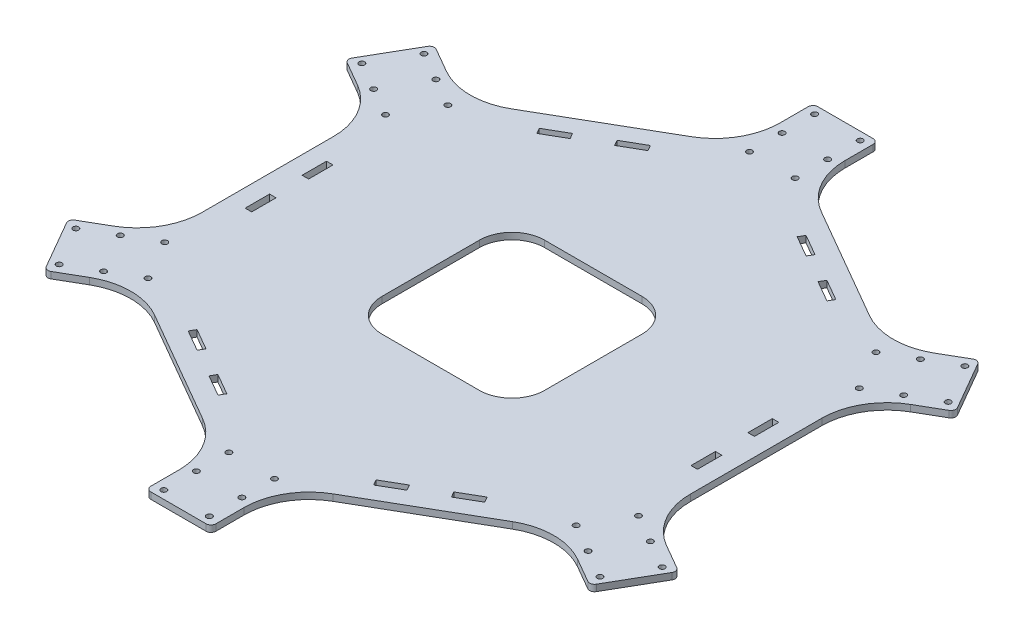
from build123d import *

# Parameters (mm, degrees)
SKETCH4_R           = 1.75
SKETCH4_W           = 4
SKETCH4_H           = 15
BOSS_EXTRUDE3_DEPTH = 2
FILLET1_R           = 3
CIRPATTERN4_START   = -2
CIRPATTERN4_DEPTH   = 4
CUT_EXTRUDE1_DEPTH  = 4


# Read off the part's stored shape, not the designer's step: CirPattern4
with BuildPart() as part:
    # Sketch4 → Boss-Extrude3 (new, symmetric)
    with BuildSketch(Plane(origin=(0, 0, 0), x_dir=(1, 0, 0), z_dir=(0, 1, 0))):
        with BuildLine():
            Line((-109.999962696, -109.696549489), (-39.999982783, -150.111103124))
            ThreePointArc((-39.999982783, -150.111103124), (-25.358978878, -164.752117943), (-20, -184.752109335))
            Line((-20, -184.752109335), (-20, -205))
            Line((-20, -205), (20, -205))
            Line((20, -205), (20, -184.752062947))
            ThreePointArc((20, -184.752062947), (25.358988819, -164.752054338), (40.000017217, -150.111036855))
            Line((40.000017217, -150.111036855), (110.000037304, -109.696552803))
            ThreePointArc((110.000037304, -109.696552803), (130.000030027, -104.337578894), (150.000020087, -109.696562743))
            Line((150.000020087, -109.696562743), (167.535207776, -119.820508076))
            Line((167.535207776, -119.820508076), (187.535207776, -85.179491924))
            Line((187.535207776, -85.179491924), (169.999979913, -75.055523398))
            ThreePointArc((169.999979913, -75.055523398), (155.358958792, -60.414498638), (149.999979913, -40.414487366))
            Line((149.999979913, -40.414487366), (150.000020087, 40.414550321))
            ThreePointArc((150.000020087, 40.414550321), (155.359008905, 60.414539049), (170.000020087, 75.055546592))
            Line((170.000020087, 75.055546592), (187.535207776, 85.179491924))
            Line((187.535207776, 85.179491924), (167.535207776, 119.820508076))
            Line((167.535207776, 119.820508076), (149.999979913, 109.696539549))
            ThreePointArc((149.999979913, 109.696539549), (129.999969973, 104.3375557), (109.999962696, 109.696549489))
            Line((109.999962696, 109.696549489), (39.999982783, 150.111103124))
            ThreePointArc((39.999982783, 150.111103124), (25.358978878, 164.752117943), (20, 184.752109335))
            Line((20, 184.752109335), (20, 205))
            Line((20, 205), (-20, 205))
            Line((-20, 205), (-20, 184.752062947))
            ThreePointArc((-20, 184.752062947), (-25.358988819, 164.752054338), (-40.000017217, 150.111036855))
            Line((-40.000017217, 150.111036855), (-110.000037304, 109.696552803))
            ThreePointArc((-110.000037304, 109.696552803), (-130.000030027, 104.337578894), (-150.000020087, 109.696562743))
            Line((-150.000020087, 109.696562743), (-167.535207776, 119.820508076))
            Line((-167.535207776, 119.820508076), (-187.535207776, 85.179491924))
            Line((-187.535207776, 85.179491924), (-169.999979913, 75.055523398))
            ThreePointArc((-169.999979913, 75.055523398), (-155.358958792, 60.414498638), (-149.999979913, 40.414487366))
            Line((-149.999979913, 40.414487366), (-150.000020087, -40.414550321))
            ThreePointArc((-150.000020087, -40.414550321), (-155.359008905, -60.414539049), (-170.000020087, -75.055546592))
            Line((-170.000020087, -75.055546592), (-187.535207776, -85.179491924))
            Line((-187.535207776, -85.179491924), (-167.535207776, -119.820508076))
            Line((-167.535207776, -119.820508076), (-149.999979913, -109.696539549))
            ThreePointArc((-149.999979913, -109.696539549), (-129.999969973, -104.3375557), (-109.999962696, -109.696549489))
        make_face()
        with Locations(Location((-14, 200, 0), (0, 0, 270))):
            Circle(SKETCH4_R, mode=Mode.SUBTRACT)
        with Locations(Location((-14, 180, 0), (0, 0, 270))):
            Circle(SKETCH4_R, mode=Mode.SUBTRACT)
        with Locations(Location((-14, 160, 0), (0, 0, 270))):
            Circle(SKETCH4_R, mode=Mode.SUBTRACT)
        with Locations(Location((14, 200, 0), (0, 0, 270))):
            Circle(SKETCH4_R, mode=Mode.SUBTRACT)
        with Locations(Location((14, 180, 0), (0, 0, 270))):
            Circle(SKETCH4_R, mode=Mode.SUBTRACT)
        with Locations(Location((14, 160, 0), (0, 0, 270))):
            Circle(SKETCH4_R, mode=Mode.SUBTRACT)
        with Locations(Location((131.564064606, 92.124355653, 0), (0, 0, 270))):
            Circle(SKETCH4_R, mode=Mode.SUBTRACT)
        with Locations(Location((148.884572681, 102.124355653, 0), (0, 0, 270))):
            Circle(SKETCH4_R, mode=Mode.SUBTRACT)
        with Locations(Location((145.564064606, 67.875644347, 0), (0, 0, 270))):
            Circle(SKETCH4_R, mode=Mode.SUBTRACT)
        with Locations(Location((180.205080757, 87.875644347, 0), (0, 0, 270))):
            Circle(SKETCH4_R, mode=Mode.SUBTRACT)
        with Locations(Location((162.884572681, 77.875644347, 0), (0, 0, 270))):
            Circle(SKETCH4_R, mode=Mode.SUBTRACT)
        with Locations(Location((166.205080757, 112.124355653, 0), (0, 0, 270))):
            Circle(SKETCH4_R, mode=Mode.SUBTRACT)
        with Locations(Location((145.564064606, -67.875644347, 0), (0, 0, 270))):
            Circle(SKETCH4_R, mode=Mode.SUBTRACT)
        with Locations(Location((162.884572681, -77.875644347, 0), (0, 0, 270))):
            Circle(SKETCH4_R, mode=Mode.SUBTRACT)
        with Locations(Location((131.564064606, -92.124355653, 0), (0, 0, 270))):
            Circle(SKETCH4_R, mode=Mode.SUBTRACT)
        with Locations(Location((166.205080757, -112.124355653, 0), (0, 0, 270))):
            Circle(SKETCH4_R, mode=Mode.SUBTRACT)
        with Locations(Location((148.884572681, -102.124355653, 0), (0, 0, 270))):
            Circle(SKETCH4_R, mode=Mode.SUBTRACT)
        with Locations(Location((180.205080757, -87.875644347, 0), (0, 0, 270))):
            Circle(SKETCH4_R, mode=Mode.SUBTRACT)
        with Locations(Location((14, -160, 0), (0, 0, 270))):
            Circle(SKETCH4_R, mode=Mode.SUBTRACT)
        with Locations(Location((14, -180, 0), (0, 0, 270))):
            Circle(SKETCH4_R, mode=Mode.SUBTRACT)
        with Locations(Location((-14, -160, 0), (0, 0, 270))):
            Circle(SKETCH4_R, mode=Mode.SUBTRACT)
        with Locations(Location((-14, -200, 0), (0, 0, 270))):
            Circle(SKETCH4_R, mode=Mode.SUBTRACT)
        with Locations(Location((-14, -180, 0), (0, 0, 270))):
            Circle(SKETCH4_R, mode=Mode.SUBTRACT)
        with Locations(Location((14, -200, 0), (0, 0, 270))):
            Circle(SKETCH4_R, mode=Mode.SUBTRACT)
        with Locations(Location((-131.564064605, -92.124355653, 0), (0, 0, 270))):
            Circle(SKETCH4_R, mode=Mode.SUBTRACT)
        with Locations(Location((-148.884572681, -102.124355653, 0), (0, 0, 270))):
            Circle(SKETCH4_R, mode=Mode.SUBTRACT)
        with Locations(Location((-145.564064605, -67.875644347, 0), (0, 0, 270))):
            Circle(SKETCH4_R, mode=Mode.SUBTRACT)
        with Locations(Location((-180.205080757, -87.875644347, 0), (0, 0, 270))):
            Circle(SKETCH4_R, mode=Mode.SUBTRACT)
        with Locations(Location((-162.884572681, -77.875644347, 0), (0, 0, 270))):
            Circle(SKETCH4_R, mode=Mode.SUBTRACT)
        with Locations(Location((-166.205080757, -112.124355653, 0), (0, 0, 270))):
            Circle(SKETCH4_R, mode=Mode.SUBTRACT)
        with Locations(Location((-145.564064606, 67.875644347, 0), (0, 0, 270))):
            Circle(SKETCH4_R, mode=Mode.SUBTRACT)
        with Locations(Location((-162.884572681, 77.875644347, 0), (0, 0, 270))):
            Circle(SKETCH4_R, mode=Mode.SUBTRACT)
        with Locations(Location((-131.564064606, 92.124355653, 0), (0, 0, 270))):
            Circle(SKETCH4_R, mode=Mode.SUBTRACT)
        with Locations(Location((-166.205080757, 112.124355653, 0), (0, 0, 270))):
            Circle(SKETCH4_R, mode=Mode.SUBTRACT)
        with Locations(Location((-148.884572681, 102.124355653, 0), (0, 0, 270))):
            Circle(SKETCH4_R, mode=Mode.SUBTRACT)
        with Locations(Location((-180.205080757, 87.875644347, 0), (0, 0, 270))):
            Circle(SKETCH4_R, mode=Mode.SUBTRACT)
        with Locations((137, 17.5)):
            Rectangle(SKETCH4_W, SKETCH4_H, mode=Mode.SUBTRACT)
        with Locations((137, -17.5)):
            Rectangle(SKETCH4_W, SKETCH4_H, mode=Mode.SUBTRACT)
        Polygon((60.839745962, -125.377531126), (47.849364905, -132.877531126), (45.849364905, -129.413429511), (58.839745962, -121.913429511), align=None, mode=Mode.SUBTRACT)
        Polygon((76.160254038, -111.913429511), (78.160254038, -115.377531126), (91.150635095, -107.877531126), (89.150635095, -104.413429511), align=None, mode=Mode.SUBTRACT)
        Polygon((-78.160254038, -115.377531126), (-91.150635095, -107.877531126), (-89.150635095, -104.413429511), (-76.160254038, -111.913429511), align=None, mode=Mode.SUBTRACT)
        Polygon((-58.839745962, -121.913429511), (-60.839745962, -125.377531126), (-47.849364905, -132.877531126), (-45.849364905, -129.413429511), align=None, mode=Mode.SUBTRACT)
        with Locations((-137, 17.5)):
            Rectangle(SKETCH4_W, SKETCH4_H, mode=Mode.SUBTRACT)
        with Locations((-137, -17.5)):
            Rectangle(SKETCH4_W, SKETCH4_H, mode=Mode.SUBTRACT)
        Polygon((-60.839745962, 125.377531126), (-47.849364905, 132.877531126), (-45.849364905, 129.413429511), (-58.839745962, 121.913429511), align=None, mode=Mode.SUBTRACT)
        Polygon((-76.160254038, 111.913429511), (-78.160254038, 115.377531126), (-91.150635095, 107.877531126), (-89.150635095, 104.413429511), align=None, mode=Mode.SUBTRACT)
        Polygon((78.160254038, 115.377531126), (91.150635095, 107.877531126), (89.150635095, 104.413429511), (76.160254038, 111.913429511), align=None, mode=Mode.SUBTRACT)
        Polygon((58.839745962, 121.913429511), (60.839745962, 125.377531126), (47.849364905, 132.877531126), (45.849364905, 129.413429511), align=None, mode=Mode.SUBTRACT)
    extrude(amount=BOSS_EXTRUDE3_DEPTH, both=True)

    # Fillet1
    fillet1_edges = [part.edges().sort_by_distance(p)[0] for p in [
        (-20, 0, -205),
        (20, 0, -205),
    ]]
    fillet(fillet1_edges, radius=FILLET1_R)

    # CirPattern4 outline → CirPattern4 (cut)
    with BuildSketch(Plane(origin=(0, 0, 0), x_dir=(1, 0, 0), z_dir=(0, 1, 0)).offset(CIRPATTERN4_START)):
        with BuildLine():
            Line((187.535207776, 85.179491924), (186.035207776, 87.777568136))
            ThreePointArc((186.035207776, 87.777568136), (186.334909043, 85.501111), (184.937131564, 83.679491924))
            Line((184.937131564, 83.679491924), (187.535207776, 85.179491924))
        make_face()
        with BuildLine():
            ThreePointArc((164.937131564, 118.320508076), (167.2135887, 118.620209343), (169.035207776, 117.222431864))
            Line((169.035207776, 117.222431864), (167.535207776, 119.820508076))
            Line((167.535207776, 119.820508076), (164.937131564, 118.320508076))
        make_face()
        with BuildLine():
            Line((167.535207776, -119.820508076), (169.035207776, -117.222431864))
            ThreePointArc((169.035207776, -117.222431864), (167.2135887, -118.620209343), (164.937131564, -118.320508076))
            Line((164.937131564, -118.320508076), (167.535207776, -119.820508076))
        make_face()
        with BuildLine():
            ThreePointArc((184.937131564, -83.679491924), (186.334909043, -85.501111), (186.035207776, -87.777568136))
            Line((186.035207776, -87.777568136), (187.535207776, -85.179491924))
            Line((187.535207776, -85.179491924), (184.937131564, -83.679491924))
        make_face()
        with BuildLine():
            Line((-20, -205), (-17, -205))
            ThreePointArc((-17, -205), (-19.121320344, -204.121320344), (-20, -202))
            Line((-20, -202), (-20, -205))
        make_face()
        with BuildLine():
            ThreePointArc((20, -202), (19.121320343, -204.121320344), (17, -205))
            Line((17, -205), (20, -205))
            Line((20, -205), (20, -202))
        make_face()
        with BuildLine():
            Line((-187.535207776, -85.179491924), (-186.035207776, -87.777568136))
            ThreePointArc((-186.035207776, -87.777568136), (-186.334909043, -85.501111), (-184.937131564, -83.679491924))
            Line((-184.937131564, -83.679491924), (-187.535207776, -85.179491924))
        make_face()
        with BuildLine():
            ThreePointArc((-164.937131564, -118.320508076), (-167.2135887, -118.620209343), (-169.035207776, -117.222431864))
            Line((-169.035207776, -117.222431864), (-167.535207776, -119.820508076))
            Line((-167.535207776, -119.820508076), (-164.937131564, -118.320508076))
        make_face()
        with BuildLine():
            Line((-167.535207776, 119.820508076), (-169.035207776, 117.222431864))
            ThreePointArc((-169.035207776, 117.222431864), (-167.2135887, 118.620209343), (-164.937131564, 118.320508076))
            Line((-164.937131564, 118.320508076), (-167.535207776, 119.820508076))
        make_face()
        with BuildLine():
            ThreePointArc((-184.937131564, 83.679491924), (-186.334909043, 85.501111), (-186.035207776, 87.777568136))
            Line((-186.035207776, 87.777568136), (-187.535207776, 85.179491924))
            Line((-187.535207776, 85.179491924), (-184.937131564, 83.679491924))
        make_face()
    extrude(amount=CIRPATTERN4_DEPTH, mode=Mode.SUBTRACT)

    # Sketch5 → Cut-Extrude1 (cut)
    with BuildSketch(Plane(origin=(0, 2, 0), x_dir=(1, 0, 0), z_dir=(0, 1, 0))):
        with BuildLine():
            Line((-30, 50), (30, 50))
            ThreePointArc((30, 50), (44.142135624, 44.142135624), (50, 30))
            Line((50, 30), (50, -30))
            ThreePointArc((50, -30), (44.142135624, -44.142135624), (30, -50))
            Line((30, -50), (-30, -50))
            ThreePointArc((-30, -50), (-44.142135624, -44.142135624), (-50, -30))
            Line((-50, -30), (-50, 30))
            ThreePointArc((-50, 30), (-44.142135624, 44.142135624), (-30, 50))
        make_face()
    extrude(amount=-CUT_EXTRUDE1_DEPTH, mode=Mode.SUBTRACT)


solid = part.part
